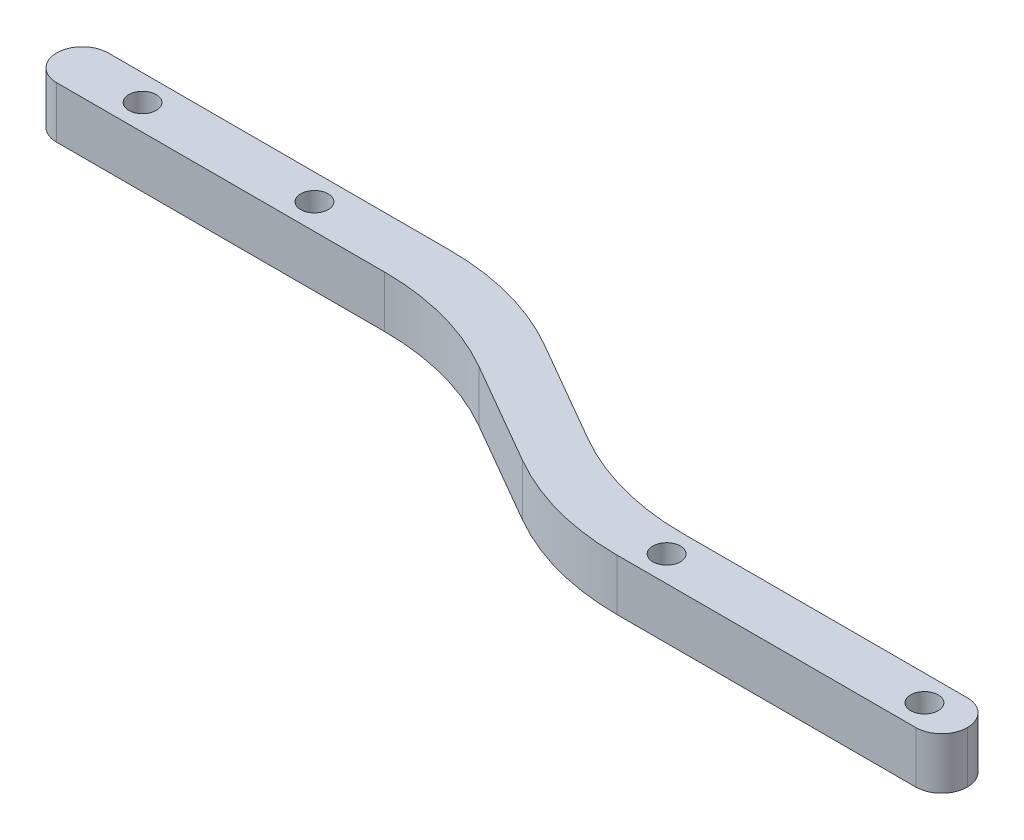
from build123d import *

# Parameters (mm, degrees)
BOSS_EXTRUDE1_DEPTH = 3
SKETCH2_R           = 1.6
CUT_EXTRUDE1_DEPTH  = 101.19374018
FILLET1_R           = 30
FILLET2_R           = 3


with BuildPart() as part:
    # Sketch1 → Boss-Extrude1 (new, symmetric)
    with BuildSketch(Plane(origin=(0, 0, 0), x_dir=(1, 0, 0), z_dir=(0, 1, 0))):
        Polygon((22.098076211, 0), (-22.098076211, 0), (-48.078838325, 15), (-98.882685902, 15), (-98.882685902, 9), (-49.686533479, 9), (-23.705771366, -6), (22.098076211, -6), align=None)
    extrude(amount=BOSS_EXTRUDE1_DEPTH, both=True)

    # Sketch2 → Cut-Extrude1 (cut, through all)
    with BuildSketch(Plane(origin=(0, 3, 0), x_dir=(1, 0, 0), z_dir=(0, 1, 0))):
        with Locations(Location((17.098076211, -3, 0), (0, 0, 270))):
            Circle(SKETCH2_R)
        with Locations(Location((-12.901923789, -3, 0), (0, 0, 270))):
            Circle(SKETCH2_R)
        with Locations(Location((-68.882685902, 12, 0), (0, 0, 270))):
            Circle(SKETCH2_R)
        with Locations(Location((-88.882685902, 12, 0), (0, 0, 270))):
            Circle(SKETCH2_R)
    extrude(amount=-CUT_EXTRUDE1_DEPTH, mode=Mode.SUBTRACT)

    # Fillet1
    fillet1_edges = [part.edges().sort_by_distance(p)[0] for p in [
        (-22.098076211, 0, 0),
        (-23.705771366, 0, 6),
        (-49.686533479, 0, -9),
        (-48.078838325, 0, -15),
    ]]
    fillet(fillet1_edges, radius=FILLET1_R)

    # Fillet2
    fillet2_edges = [part.edges().sort_by_distance(p)[0] for p in [
        (-98.882685902, 0, -9),
        (-98.882685902, 0, -15),
        (22.098076211, 0, 6),
        (22.098076211, 0, 0),
    ]]
    fillet(fillet2_edges, radius=FILLET2_R - 0.0001)  # a hair under: the kernel refuses the full size


solid = part.part
